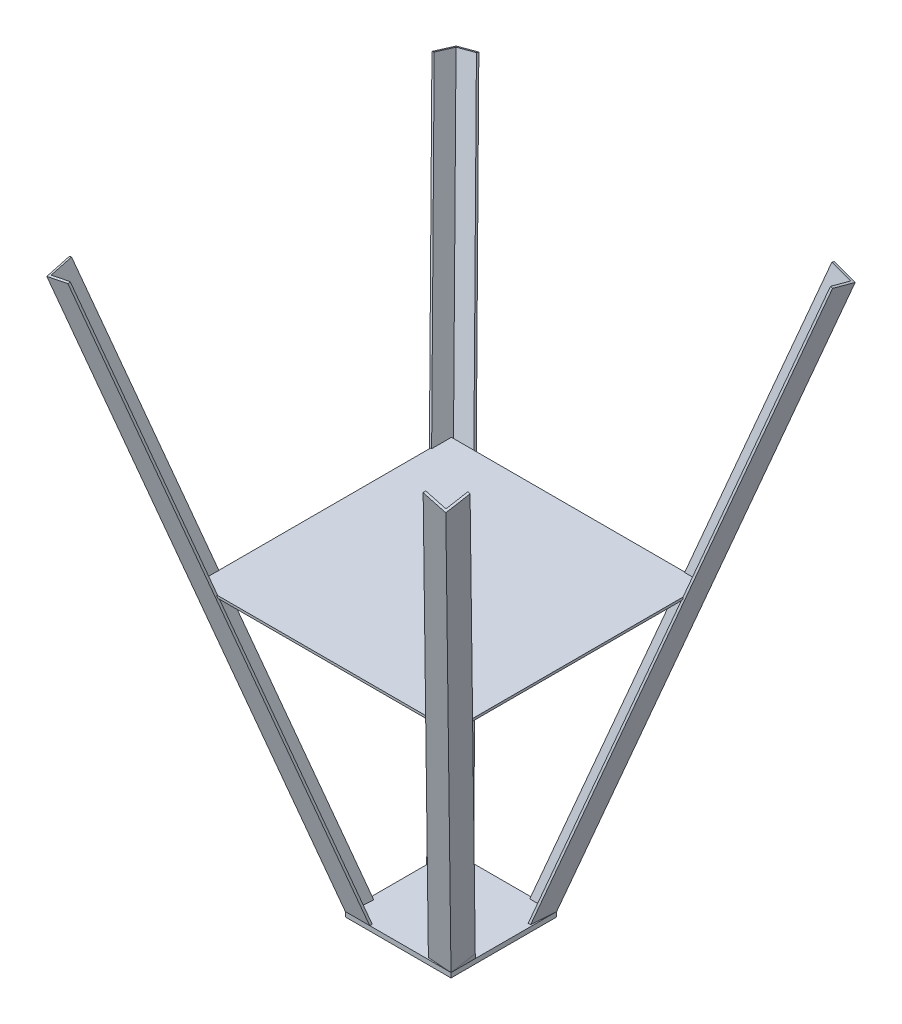
from build123d import *

# Parameters (mm, degrees)
BOSS_EXTRUDE3_DEPTH     = 1270
BODY_MOVE_COPY1_ANGLE   = 21.18282227
BODY_MOVE_COPY2_START   = -102.748673771
BODY_MOVE_COPY2_DEPTH   = 5.08
BODY_MOVE_COPY2_START_2 = -97.668673771
BODY_MOVE_COPY2_2_DEPTH = 45.72
BODY_MOVE_COPY2_START_3 = 51.948673771
BODY_MOVE_COPY2_3_DEPTH = 50.8
BODY_MOVE_COPY2_START_4 = 97.668673771
BODY_MOVE_COPY2_4_DEPTH = 5.08
BODY_MOVE_COPY2_5_DEPTH = 5.08
BODY_MOVE_COPY2_6_DEPTH = 45.72
BODY_MOVE_COPY2_7_DEPTH = 50.8
BODY_MOVE_COPY2_8_DEPTH = 5.08
SKETCH9_W               = 228.6
SKETCH9_H               = 228.6
SKETCH9_R               = 19.05
BOSS_EXTRUDE4_DEPTH     = 10.16
BOSS_EXTRUDE5_REACH     = 1317.434
BOSS_EXTRUDE6_REACH     = 1317.434
BOSS_EXTRUDE7_REACH     = 1317.434
BOSS_EXTRUDE8_REACH     = 1317.434
SKETCH14_W              = 552.363202232
SKETCH14_H              = 549.428754756
BOSS_EXTRUDE9_DEPTH     = 5.08


# Read off the part's stored shape, not the designer's step: Body-Move/Copy2
with BuildPart() as part:
    # Sketch5 → Boss-Extrude3 (new body)
    with BuildSketch(Plane(origin=(0, 0, 0), x_dir=(1, 0, 0), z_dir=(0, 1, 0))):
        Polygon((63.5, 114.3), (63.5, 109.22), (109.22, 109.22), (109.22, 63.5), (114.3, 63.5), (114.3, 114.3), align=None)
    extrude(amount=BOSS_EXTRUDE3_DEPTH)


with BuildPart() as part_1:
    # Body-Move/Copy1: moved
    add(part.part.moved(Location((0, 0, 0))).rotate(Axis((114.3, 0, -114.3), (-0.7040625922196366, -0.09269159872357137, -0.7040625922196366)), BODY_MOVE_COPY1_ANGLE))



with BuildPart() as body_2:
    # Body-Move/Copy2 outline → Body-Move/Copy2 (new body)
    with BuildSketch(Plane(origin=(0, 0, 0), x_dir=(-0.24940097592594676, 0.9682458365518541, -0.01729604599858925), z_dir=(0.9659258262890689, 0.24999999999999997, 0.06698729810777361)).offset(BODY_MOVE_COPY2_START)):
        Polygon((1250.316039733, 461.413972086), (26.529593491, 121.933878424), (40.108797237, 72.982420574), (1263.89524348, 412.462514236), align=None)
    extrude(amount=BODY_MOVE_COPY2_DEPTH)

    # Body-Move_Copy2 2 outline → Body-Move_Copy2 2 (add)
    with BuildSketch(Plane(origin=(0, 0, 0), x_dir=(-0.24940097592594676, 0.9682458365518541, -0.01729604599858925), z_dir=(0.9659258262890689, 0.24999999999999997, 0.06698729810777361)).offset(BODY_MOVE_COPY2_START_2)):
        Polygon((1250.316039733, 461.413972086), (26.529593491, 121.933878424), (27.887513866, 117.038732639), (1251.673960108, 456.518826301), align=None)
    extrude(amount=BODY_MOVE_COPY2_2_DEPTH)


with BuildPart() as body_3:
    # Body-Move_Copy2 3 outline → Body-Move_Copy2 3 (new body)
    with BuildSketch(Plane(origin=(0, 0, 0), x_dir=(0.9977538283024625, 0.01678452545297333, 0.06485042646813265), z_dir=(0.06698729810777702, -0.2500000000000001, -0.9659258262890686)).offset(BODY_MOVE_COPY2_START_3)):
        Polygon((-121.45566632, -28.63932885), (-439.670431319, -1258.126768126), (-434.752481562, -1259.399627186), (-116.537716563, -29.91218791), align=None)
    extrude(amount=BODY_MOVE_COPY2_3_DEPTH)

    # Body-Move_Copy2 4 outline → Body-Move_Copy2 4 (add)
    with BuildSketch(Plane(origin=(0, 0, 0), x_dir=(0.9977538283024625, 0.01678452545297333, 0.06485042646813265), z_dir=(0.06698729810777702, -0.2500000000000001, -0.9659258262890686)).offset(BODY_MOVE_COPY2_START_4)):
        Polygon((-116.537716563, -29.91218791), (-434.752481562, -1259.399627186), (-390.490933748, -1270.855358726), (-72.276168749, -41.36791945), align=None)
    extrude(amount=BODY_MOVE_COPY2_4_DEPTH)


with BuildPart() as body_4:
    # Body-Move_Copy2 5 outline → Body-Move_Copy2 5 (new body)
    with BuildSketch(Plane(origin=(0, 0, 0), x_dir=(0.997753828302463, -0.016784525452971634, 0.06485042646812614), z_dir=(0.06698729810777031, 0.25000000000000006, -0.965925826289069)).offset(BODY_MOVE_COPY2_START)):
        Polygon((439.670431319, -1258.126768126), (121.45566632, -28.63932885), (72.276168749, -41.36791945), (390.490933748, -1270.855358726), align=None)
    extrude(amount=BODY_MOVE_COPY2_5_DEPTH)

    # Body-Move_Copy2 6 outline → Body-Move_Copy2 6 (add)
    with BuildSketch(Plane(origin=(0, 0, 0), x_dir=(0.997753828302463, -0.016784525452971634, 0.06485042646812614), z_dir=(0.06698729810777031, 0.25000000000000006, -0.965925826289069)).offset(BODY_MOVE_COPY2_START_2)):
        Polygon((439.670431319, -1258.126768126), (121.45566632, -28.63932885), (116.537716563, -29.91218791), (434.752481562, -1259.399627186), align=None)
    extrude(amount=BODY_MOVE_COPY2_6_DEPTH)


with BuildPart() as body_5:
    # Body-Move_Copy2 7 outline → Body-Move_Copy2 7 (new body)
    with BuildSketch(Plane(origin=(0, 0, 0), x_dir=(0.24940097592594668, 0.9682458365518541, 0.01729604599859101), z_dir=(0.9659258262890682, -0.25000000000000006, 0.06698729810778041)).offset(BODY_MOVE_COPY2_START_3)):
        Polygon((26.529593491, -121.933878424), (1250.316039733, -461.413972086), (1251.673960108, -456.518826301), (27.887513865, -117.038732639), align=None)
    extrude(amount=BODY_MOVE_COPY2_7_DEPTH)

    # Body-Move_Copy2 8 outline → Body-Move_Copy2 8 (add)
    with BuildSketch(Plane(origin=(0, 0, 0), x_dir=(0.24940097592594668, 0.9682458365518541, 0.01729604599859101), z_dir=(0.9659258262890682, -0.25000000000000006, 0.06698729810778041)).offset(BODY_MOVE_COPY2_START_4)):
        Polygon((27.887513865, -117.038732639), (1251.673960108, -456.518826301), (1263.89524348, -412.462514236), (40.108797237, -72.982420574), align=None)
    extrude(amount=BODY_MOVE_COPY2_8_DEPTH)


with BuildPart() as part_2:
    add(part_1.part)

    add(body_2.part)  # Boss-Extrude4 merges body 2

    add(body_3.part)  # Boss-Extrude4 merges body 3

    add(body_4.part)  # Boss-Extrude4 merges body 4

    add(body_5.part)  # Boss-Extrude4 merges body 5
    # Sketch9 → Boss-Extrude4 (add)
    with BuildSketch(Plane(origin=(0, 0, 0), x_dir=(1, 0, 0), z_dir=(0, 1, 0))):
        Rectangle(SKETCH9_W, SKETCH9_H)
        with Locations(Location((0, 0, 0), (0, 0, 270))):
            Circle(SKETCH9_R, mode=Mode.SUBTRACT)
    extrude(amount=-BOSS_EXTRUDE4_DEPTH)

    # Boss-Extrude5: up to this face of the body (flat: up to its plane)
    boss_extrude5_end = Plane(part_2.part.faces().sort_by_distance((0, 0, 111.067107796))[0])
    # Sketch10 → Boss-Extrude5 (add, up to the picked face)
    with BuildSketch(Plane(origin=(14.539504214, 54.262168443, 15.052402388), x_dir=(0.9682458365518536, -0.24090284374857285, -0.06682679009089139), z_dir=(-0.2500000000000027, -0.9330127018922193, -0.25881904510251824)), mode=Mode.PRIVATE) as boss_extrude5_sk1:
        Polygon((52.353918702, 106.626223615), (52.705374357, 101.558395784), (98.315824834, 104.721496676), (101.478925727, 59.111046199), (106.546753557, 59.111046199), (103.03219701, 110.140780162), align=None)
    boss_extrude5_tool1 = split(extrude(boss_extrude5_sk1.sketch, amount=BOSS_EXTRUDE5_REACH, mode=Mode.PRIVATE), bisect_by=boss_extrude5_end, keep=Keep.BOTH, mode=Mode.PRIVATE)
    add(boss_extrude5_tool1.solids().sort_by(Axis((66.120124, 13.59035, 111.846548), (-0.2500000000000027, -0.9330127018922193, -0.25881904510251824)))[0])

    # Boss-Extrude6: up to this face of the body (flat: up to its plane)
    boss_extrude6_end = Plane(part_2.part.faces().sort_by_distance((-111.067107796, 0, 0))[0])
    # Sketch11 → Boss-Extrude6 (add, up to the picked face)
    with BuildSketch(Plane(origin=(15.052402388, 54.262168443, -14.539504214), x_dir=(0.9659258262890683, -0.25000000000000006, 0.06698729810778066), z_dir=(-0.2588190451025208, -0.9330127018922194, 0.24999999999999992)), mode=Mode.PRIVATE) as boss_extrude6_sk1:
        Polygon((97.668673771, -105.325321945), (51.948673771, -105.325321945), (51.948673771, -110.405321945), (102.748673771, -110.405321945), (102.748673771, -59.605321945), (97.668673771, -59.605321945), align=None)
    boss_extrude6_tool1 = split(extrude(boss_extrude6_sk1.sketch, amount=BOSS_EXTRUDE6_REACH, mode=Mode.PRIVATE), bisect_by=boss_extrude6_end, keep=Keep.BOTH, mode=Mode.PRIVATE)
    add(boss_extrude6_tool1.solids().sort_by(Axis((87.312032, 8.11386, -111.958663), (-0.2588190451025208, -0.9330127018922194, 0.24999999999999992)))[0])

    # Boss-Extrude7: up to this face of the body (flat: up to its plane)
    boss_extrude7_end = Plane(part_2.part.faces().sort_by_distance((-26.296014982, 0, -111.067107796))[0])
    # Sketch12 → Boss-Extrude7 (add, up to the picked face)
    with BuildSketch(Plane(origin=(-14.539504214, 54.262168443, -15.052402388), x_dir=(0.968245836551854, 0.24090284374857102, -0.0668267900908913), z_dir=(0.25000000000000094, -0.9330127018922194, 0.25881904510251985)), mode=Mode.PRIVATE) as boss_extrude7_sk1:
        Polygon((-101.478925727, -59.111046199), (-106.546753557, -59.462501854), (-103.03219701, -110.140780162), (-52.353918702, -106.626223615), (-52.705374357, -101.558395784), (-98.315824834, -104.721496676), align=None)
    boss_extrude7_tool1 = split(extrude(boss_extrude7_sk1.sketch, amount=BOSS_EXTRUDE7_REACH, mode=Mode.PRIVATE), bisect_by=boss_extrude7_end, keep=Keep.BOTH, mode=Mode.PRIVATE)
    add(boss_extrude7_tool1.solids().sort_by(Axis((-115.19964, 13.171307, -65.949976), (0.25000000000000094, -0.9330127018922194, 0.25881904510251985)))[0])

    # Boss-Extrude8: up to this face of the body (flat: up to its plane)
    boss_extrude8_end = Plane(part_2.part.faces().sort_by_distance((58.300460358, 0, -111.894063511))[0])
    # Sketch13 → Boss-Extrude8 (add, up to the picked face)
    with BuildSketch(Plane(origin=(-15.052402388, 54.262168443, 14.539504214), x_dir=(0.9659258262890688, 0.2499999999999983, 0.06698729810778069), z_dir=(0.25881904510251913, -0.9330127018922194, -0.2500000000000018)), mode=Mode.PRIVATE) as boss_extrude8_sk1:
        Polygon((-97.668673771, 105.325321945), (-51.948673771, 105.325321945), (-51.948673771, 110.405321945), (-102.748673771, 110.405321945), (-102.748673771, 59.605321945), (-97.668673771, 59.605321945), align=None)
    boss_extrude8_tool1 = split(extrude(boss_extrude8_sk1.sketch, amount=BOSS_EXTRUDE8_REACH, mode=Mode.PRIVATE), bisect_by=boss_extrude8_end, keep=Keep.BOTH, mode=Mode.PRIVATE)
    add(boss_extrude8_tool1.solids().sort_by(Axis((-87.312032, 8.11386, 111.958663), (0.25881904510251913, -0.9330127018922194, -0.2500000000000018)))[0])

    # Sketch14 → Boss-Extrude9 (add)
    with BuildSketch(Plane(origin=(0, 609.6, 0), x_dir=(1, 0, 0), z_dir=(0, 1, 0))):
        Rectangle(SKETCH14_W, SKETCH14_H)
    extrude(amount=BOSS_EXTRUDE9_DEPTH)


solid = part_2.part
